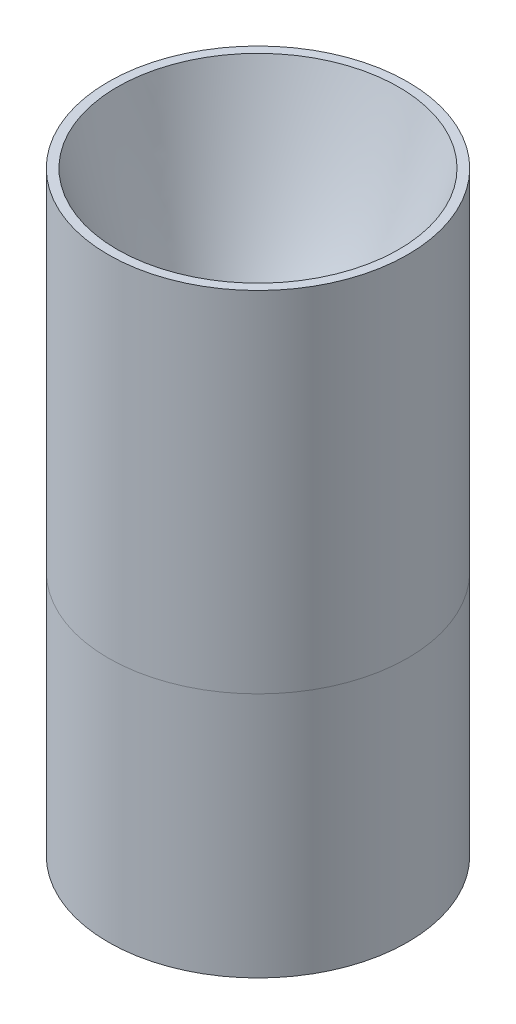
from build123d import *

# Parameters (mm, degrees)
SHORTEN_CHAMBER_75IN_BY = 19.05
SPLIT1_SURFACE_1_BACK   = 372.838
SPLIT1_SURFACE_1_DEPTH  = 745.676
SPLIT1_SURFACE_2_BACK   = 372.838
SPLIT1_SURFACE_2_DEPTH  = 745.676


with BuildPart() as part:
    # Sketch1 → Revolve2 (revolve)
    with BuildSketch(Plane.XY):
        with BuildLine():
            Line((71.638455479, 109.927347077), (76.2, 109.927347077))
            Line((76.2, 109.927347077), (76.2, -212.127673706))
            Line((76.2, -212.127673706), (53.792460243, -212.127673706))
            Line((53.792460243, -212.127673706), (53.792460243, -59.727673706))
            add(Edge.make_bspline(
                [(53.792460243, -59.727673706), (53.79245901, -59.657143635), (53.791929865, -59.515566582), (53.78955401, -59.181725095), (53.783229407, -58.904955972), (53.773743915, -58.532727967), (53.761101012, -58.212998101), (53.741350178, -57.781754922), (53.71133783, -57.281120379), (53.667125658, -56.688158646), (53.588220976, -55.848640848), (53.488359374, -55.008326344), (53.367608286, -54.172595915), (53.197743308, -53.172585727), (53.002996658, -52.177603312), (52.777307577, -51.188699577), (52.520946667, -50.207649536), (52.240221768, -49.233238242), (51.935281153, -48.26612973), (51.544470229, -47.149295579), (51.05045274, -45.890568924), (50.509666114, -44.65112933), (49.922993271, -43.432862061), (49.291052557, -42.237253783), (48.615057538, -41.066315433), (47.895407812, -39.921133222), (47.134034414, -38.804236815), (46.430801323, -37.851612371), (45.804470188, -37.055832718), (45.263749922, -36.403541885), (44.826059182, -35.894408242), (44.425708417, -35.447153273), (44.092389725, -35.084791805), (43.784856841, -34.760500776), (43.585004621, -34.551710078), (43.355324283, -34.318676919), (43.25471536, -34.217322688), (43.204843213, -34.167450302)],
                knots=[0.082637729, 0.082637729, 0.082637729, 0.082637729, 0.082637729, 0.092574926, 0.102512123, 0.11244932, 0.122386517, 0.132323714, 0.142260911, 0.162135305, 0.182009699, 0.201884093, 0.24163288, 0.261507274, 0.281381668, 0.321130456, 0.360879243, 0.380753637, 0.400628031, 0.440376819, 0.480125606, 0.519874394, 0.559623181, 0.599371969, 0.639120757, 0.678869544, 0.718618332, 0.75836712, 0.798115907, 0.817990301, 0.837864695, 0.857739089, 0.877613483, 0.88755068, 0.897487877, 0.907425074, 0.91736227, 0.91736227, 0.91736227, 0.91736227, 0.91736227], degree=4))
            Line((43.204843213, -34.167450302), (34.597215016, -25.559822106))
            add(Edge.make_bspline(
                [(24.01, 0), (24.010001231, -0.070528647), (24.010530378, -0.21358419), (24.012906065, -0.543182916), (24.01923046, -0.824160397), (24.028715582, -1.194822072), (24.041357876, -1.513435058), (24.0571581, -1.861939603), (24.07611336, -2.193706872), (24.103750975, -2.6180694), (24.143219184, -3.122033947), (24.214231846, -3.879978675), (24.33405882, -4.886450388), (24.51041819, -6.05671076), (24.761817384, -7.385166414), (25.062727469, -8.703574513), (25.412702783, -10.009637207), (25.811293148, -11.301819595), (26.25787756, -12.578099333), (26.751935496, -13.836887481), (27.292605299, -15.076197125), (27.879411568, -16.29460979), (28.511071583, -17.489938789), (29.187464585, -18.661287751), (29.906377295, -19.80574339), (30.668954196, -20.923860067), (31.370099393, -21.874411752), (31.999668326, -22.673445472), (32.535060622, -23.320422129), (32.983187975, -23.840005007), (33.419382235, -24.329816236), (33.846758332, -24.788484379), (34.156490851, -25.113868299), (34.44779217, -25.409649035), (34.547344638, -25.509949921), (34.597215016, -25.559822106)],
                knots=[0.082637729, 0.082637729, 0.082637729, 0.082637729, 0.082637729, 0.092574926, 0.102512123, 0.11244932, 0.122386517, 0.132323714, 0.142260911, 0.152198108, 0.162135305, 0.182009699, 0.201884093, 0.24163288, 0.281381668, 0.321130456, 0.360879243, 0.400628031, 0.440376819, 0.480125606, 0.519874394, 0.559623181, 0.599371969, 0.639120757, 0.678869544, 0.718618332, 0.75836712, 0.798115907, 0.817990301, 0.837864695, 0.857739089, 0.877613483, 0.897487877, 0.907425074, 0.91736227, 0.91736227, 0.91736227, 0.91736227, 0.91736227], degree=4))
            add(Edge.make_bspline(
                [(24.01, 0), (24.010000626, 0.035892652), (24.010538457, 0.11011369), (24.012955849, 0.267641069), (24.019393694, 0.427064117), (24.031465725, 0.646764266), (24.052367213, 0.901433328), (24.086116845, 1.202537273), (24.137431431, 1.542050498), (24.201475827, 1.880996777), (24.278073727, 2.21635442), (24.367255697, 2.549239421), (24.468673539, 2.878092645), (24.582551197, 3.203347041), (24.708128897, 3.523627157), (24.846218103, 3.839666733), (24.995002427, 4.149282184), (25.156944348, 4.454783123), (25.327420631, 4.751301575), (25.513446847, 5.045703861), (25.702720396, 5.325518936), (25.9153376, 5.610727543), (26.0898085, 5.832913647), (26.277277882, 6.049951637), (26.415487374, 6.208641646), (26.581374196, 6.382121779), (26.655452387, 6.458478841), (26.706211329, 6.50923965)],
                knots=[0.082568816, 0.082568816, 0.082568816, 0.082568816, 0.082568816, 0.102426634, 0.122284453, 0.142142271, 0.162000089, 0.201715725, 0.241431362, 0.281146998, 0.320862634, 0.360578271, 0.400293907, 0.440009544, 0.47972518, 0.519440816, 0.559156453, 0.598872089, 0.638587725, 0.678303362, 0.718018998, 0.757734635, 0.797450271, 0.837165907, 0.857023726, 0.876881544, 0.91659718, 0.91659718, 0.91659718, 0.91659718, 0.91659718], degree=4))
            add(Edge.make_bspline(
                [(26.706211329, 6.50923965), (49.172333461, 34.635954224), (71.638455479, 109.927347077)],
                knots=[0, 0, 0, 1, 1, 1], degree=2))
        make_face()
    revolve(axis=Axis((0, 0, 0), (0, -1, 0)))

    # shorten_chamber_.75in: a face moved inward by 19.05
    extrude(part.faces().sort_by_distance((0, -212.127673706, -60.96))[0], amount=SHORTEN_CHAMBER_75IN_BY, dir=(0, 1, 0), mode=Mode.SUBTRACT)


with BuildPart() as body_2:
    # Split1: the piece behind the surface
    add(part.part)
    # Split1 surface: a surface, the sketch's curves swept straight by 745.676 mm
    with BuildLine(Plane.XY.offset(-SPLIT1_SURFACE_1_BACK), mode=Mode.PRIVATE) as split1_surface_1_path:
        Line((-76.2, -67.872652923), (76.2, -67.872652923))
    split1_surface_1 = Shell.extrude(split1_surface_1_path.wire(), (0 * SPLIT1_SURFACE_1_DEPTH, 0 * SPLIT1_SURFACE_1_DEPTH, 1 * SPLIT1_SURFACE_1_DEPTH))
    split(bisect_by=split1_surface_1, keep=Keep.BOTTOM)


with BuildPart() as part_1:
    add(part.part)

    # Split1: split by a surface, the side it looks to stays
    # Split1 surface: a surface, the sketch's curves swept straight by 745.676 mm
    with BuildLine(Plane.XY.offset(-SPLIT1_SURFACE_2_BACK), mode=Mode.PRIVATE) as split1_surface_2_path:
        Line((-76.2, -67.872652923), (76.2, -67.872652923))
    split1_surface_2 = Shell.extrude(split1_surface_2_path.wire(), (0 * SPLIT1_SURFACE_2_DEPTH, 0 * SPLIT1_SURFACE_2_DEPTH, 1 * SPLIT1_SURFACE_2_DEPTH))
    split(bisect_by=split1_surface_2, keep=Keep.TOP)


solid = Compound([body_2.part, part_1.part])
